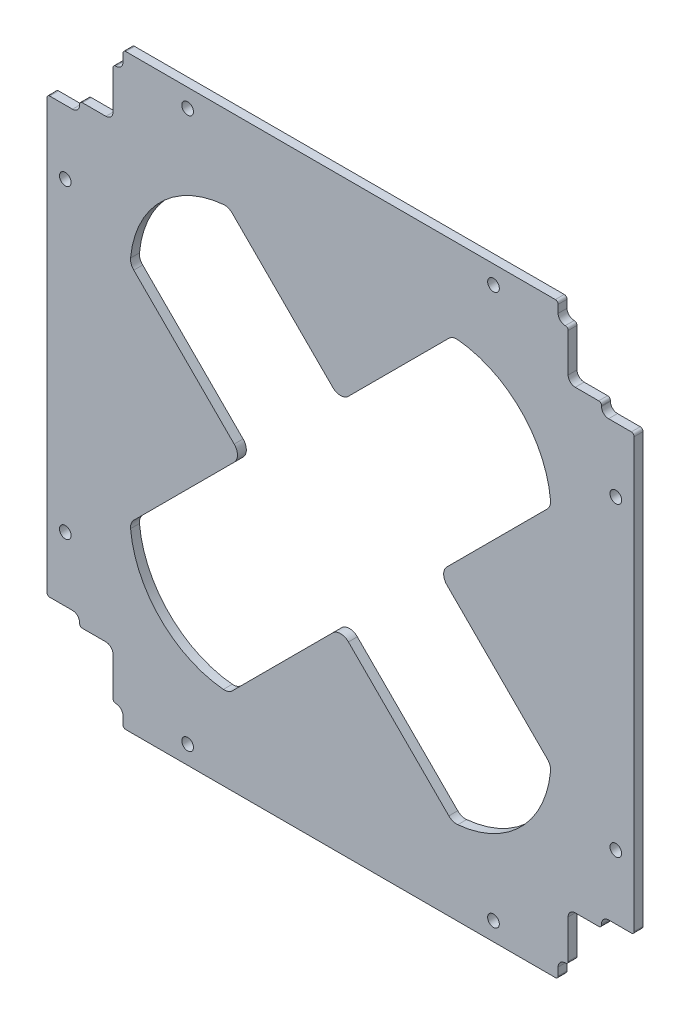
from build123d import *

# Parameters (mm, degrees)
SKETCH1_W                            = 106
SKETCH1_H                            = 106
MAINOUTLINE_DEPTH                    = 1.6
SKETCH4_W                            = 11.7
SKETCH4_H                            = 11.7
RAILCUTOUTS_DEPTH                    = 75.970394157
SKETCH13_W                           = 5.7
SKETCH13_H                           = 1.9
SKETCH13_W_2                         = 1.8
SKETCH13_H_2                         = 3
FILLETCUTOUTS_DEPTH                  = 75.970394157
SMOOTHCORNER_DEPTH                   = 10
MIRROR2_COPY_1_SKETCH_W              = 11.7
MIRROR2_COPY_1_SKETCH_H              = 11.7
MIRROR2_COPY_1_DEPTH                 = 75.970394157
MIRROR2_COPY_2_SKETCH_W              = 5.7
MIRROR2_COPY_2_SKETCH_H              = 1.9
MIRROR2_COPY_2_SKETCH_W_2            = 1.8
MIRROR2_COPY_2_SKETCH_H_2            = 3
MIRROR2_COPY_2_DEPTH                 = 75.970394157
MIRROR2_COPY_3_DEPTH                 = 10
MIRROR2_COPY_4_SKETCH_W              = 11.7
MIRROR2_COPY_4_SKETCH_H              = 11.7
MIRROR2_COPY_4_DEPTH                 = 75.970394157
MIRROR2_COPY_5_SKETCH_W              = 5.7
MIRROR2_COPY_5_SKETCH_H              = 1.9
MIRROR2_COPY_5_SKETCH_W_2            = 1.8
MIRROR2_COPY_5_SKETCH_H_2            = 3
MIRROR2_COPY_5_DEPTH                 = 75.970394157
MIRROR2_COPY_6_DEPTH                 = 10
FILLET10_R                           = 0.5
M2_CLEARANCE_HOLE1_D                 = 2.1
SKETCH15_W                           = 90
SKETCH15_H                           = 6.2
SKETCH15_W_2                         = 5.2
SKETCH15_H_2                         = 90
CUT_EXTRUDE5_DEPTH                   = 0.001
F_1I_CIRCULAR_TURNSTILE_CUTOUT_DEPTH = 10
SKETCH24_OUTSIDE_W                   = 137.984
SKETCH24_OUTSIDE_H                   = 137.984
SKETCH24_OUTSIDE_W_2                 = 105.6
SKETCH24_OUTSIDE_H_2                 = 105.6
CUT_EXTRUDE19_DEPTH                  = 75.970394157
FILLET7_R                            = 0.5
FILLET9_R                            = 2


with BuildPart() as part:
    # Sketch1 → mainOutline (new body)
    with BuildSketch(Plane.XY):
        Rectangle(SKETCH1_W, SKETCH1_H)
    extrude(amount=MAINOUTLINE_DEPTH)

    # Sketch4 → railCutouts (cut, through all)
    with BuildSketch(Plane(origin=(0, 0, 0), x_dir=(-1, 0, 0), z_dir=(0, 0, -1))):
        with Locations((47.15, 47.15)):
            Rectangle(SKETCH4_W, SKETCH4_H)
    railcutouts = extrude(amount=-RAILCUTOUTS_DEPTH, mode=Mode.SUBTRACT)

    # Sketch13 → filletCutouts (cut, symmetric)
    with BuildSketch(Plane(origin=(0, 0, 0), x_dir=(-1, 0, 0), z_dir=(0, 0, -1))):
        with Locations((50.15, 40.35)):
            Rectangle(SKETCH13_W, SKETCH13_H)
        with Locations((40.4, 51.5)):
            Rectangle(SKETCH13_W_2, SKETCH13_H_2)
    filletcutouts = extrude(amount=FILLETCUTOUTS_DEPTH, both=True, mode=Mode.SUBTRACT)

    # Sketch27 → smoothCorner (cut)
    with BuildSketch(Plane.XY.offset(1.6)):
        with BuildLine():
            Line((-40.928025612, 42.198025612), (-40.928025612, 49.628025612))
            Line((-40.928025612, 49.628025612), (-40.398025612, 49.628025612))
            ThreePointArc((-40.398025612, 49.628025612), (-39.5, 50), (-39.128025612, 50.898025612))
            Line((-39.128025612, 50.898025612), (-39.128025612, 53))
            Line((-39.128025612, 53), (-53, 53))
            Line((-53, 53), (-53, 39.028025612))
            Line((-53, 39.028025612), (-48.198025612, 39.028025612))
            ThreePointArc((-48.198025612, 39.028025612), (-47.3, 39.4), (-46.928025612, 40.298025612))
            Line((-46.928025612, 40.298025612), (-46.928025612, 40.928025612))
            Line((-46.928025612, 40.928025612), (-42.198025612, 40.928025612))
            ThreePointArc((-42.198025612, 40.928025612), (-41.3, 41.3), (-40.928025612, 42.198025612))
        make_face()
    smoothcorner = extrude(amount=-SMOOTHCORNER_DEPTH, mode=Mode.SUBTRACT)

    # Mirror1: railCutouts, filletCutouts, smoothCorner across plane
    add(railcutouts.mirror(Plane(origin=(0, 0, 0), x_dir=(0, 0, 1), z_dir=(1, 0, 0))), mode=Mode.SUBTRACT)
    add(filletcutouts.mirror(Plane(origin=(0, 0, 0), x_dir=(0, 0, 1), z_dir=(1, 0, 0))), mode=Mode.SUBTRACT)
    add(smoothcorner.mirror(Plane(origin=(0, 0, 0), x_dir=(0, 0, 1), z_dir=(1, 0, 0))), mode=Mode.SUBTRACT)

    # Mirror2 copy 1 sketch → Mirror2 copy 1 (cut, through all)
    with BuildSketch(Plane(origin=(0, 0, 0), x_dir=(1, 0, 0), z_dir=(0, 0, -1))):
        with Locations((47.15, 47.15)):
            Rectangle(MIRROR2_COPY_1_SKETCH_W, MIRROR2_COPY_1_SKETCH_H)
    extrude(amount=-MIRROR2_COPY_1_DEPTH, mode=Mode.SUBTRACT)

    # Mirror2 copy 2 sketch → Mirror2 copy 2 (cut, symmetric)
    with BuildSketch(Plane(origin=(0, 0, 0), x_dir=(1, 0, 0), z_dir=(0, 0, -1))):
        with Locations((50.15, 40.35)):
            Rectangle(MIRROR2_COPY_2_SKETCH_W, MIRROR2_COPY_2_SKETCH_H)
        with Locations((40.4, 51.5)):
            Rectangle(MIRROR2_COPY_2_SKETCH_W_2, MIRROR2_COPY_2_SKETCH_H_2)
    extrude(amount=MIRROR2_COPY_2_DEPTH, both=True, mode=Mode.SUBTRACT)

    # Mirror2 copy 3 sketch → Mirror2 copy 3 (cut)
    with BuildSketch(Plane(origin=(0, 0, 1.6), x_dir=(-1, 0, 0), z_dir=(0, 0, 1))):
        with BuildLine():
            Line((-40.928025612, 42.198025612), (-40.928025612, 49.628025612))
            Line((-40.928025612, 49.628025612), (-40.398025612, 49.628025612))
            ThreePointArc((-40.398025612, 49.628025612), (-39.5, 50), (-39.128025612, 50.898025612))
            Line((-39.128025612, 50.898025612), (-39.128025612, 53))
            Line((-39.128025612, 53), (-53, 53))
            Line((-53, 53), (-53, 39.028025612))
            Line((-53, 39.028025612), (-48.198025612, 39.028025612))
            ThreePointArc((-48.198025612, 39.028025612), (-47.3, 39.4), (-46.928025612, 40.298025612))
            Line((-46.928025612, 40.298025612), (-46.928025612, 40.928025612))
            Line((-46.928025612, 40.928025612), (-42.198025612, 40.928025612))
            ThreePointArc((-42.198025612, 40.928025612), (-41.3, 41.3), (-40.928025612, 42.198025612))
        make_face()
    extrude(amount=-MIRROR2_COPY_3_DEPTH, mode=Mode.SUBTRACT)

    # Mirror2 copy 4 sketch → Mirror2 copy 4 (cut, through all)
    with BuildSketch(Plane(origin=(0, 0, 0), x_dir=(-1, 0, 0), z_dir=(0, 0, -1))):
        with Locations((47.15, -47.15)):
            Rectangle(MIRROR2_COPY_4_SKETCH_W, MIRROR2_COPY_4_SKETCH_H)
    extrude(amount=-MIRROR2_COPY_4_DEPTH, mode=Mode.SUBTRACT)

    # Mirror2 copy 5 sketch → Mirror2 copy 5 (cut, symmetric)
    with BuildSketch(Plane(origin=(0, 0, 0), x_dir=(-1, 0, 0), z_dir=(0, 0, -1))):
        with Locations((50.15, -40.35)):
            Rectangle(MIRROR2_COPY_5_SKETCH_W, MIRROR2_COPY_5_SKETCH_H)
        with Locations((40.4, -51.5)):
            Rectangle(MIRROR2_COPY_5_SKETCH_W_2, MIRROR2_COPY_5_SKETCH_H_2)
    extrude(amount=MIRROR2_COPY_5_DEPTH, both=True, mode=Mode.SUBTRACT)

    # Mirror2 copy 6 sketch → Mirror2 copy 6 (cut)
    with BuildSketch(Plane.XY.offset(1.6)):
        with BuildLine():
            Line((-40.928025612, -42.198025612), (-40.928025612, -49.628025612))
            Line((-40.928025612, -49.628025612), (-40.398025612, -49.628025612))
            ThreePointArc((-40.398025612, -49.628025612), (-39.5, -50), (-39.128025612, -50.898025612))
            Line((-39.128025612, -50.898025612), (-39.128025612, -53))
            Line((-39.128025612, -53), (-53, -53))
            Line((-53, -53), (-53, -39.028025612))
            Line((-53, -39.028025612), (-48.198025612, -39.028025612))
            ThreePointArc((-48.198025612, -39.028025612), (-47.3, -39.4), (-46.928025612, -40.298025612))
            Line((-46.928025612, -40.298025612), (-46.928025612, -40.928025612))
            Line((-46.928025612, -40.928025612), (-42.198025612, -40.928025612))
            ThreePointArc((-42.198025612, -40.928025612), (-41.3, -41.3), (-40.928025612, -42.198025612))
        make_face()
    extrude(amount=-MIRROR2_COPY_6_DEPTH, mode=Mode.SUBTRACT)

    # Fillet10
    fillet10_edges = [part.edges().sort_by_distance(p)[0] for p in [
        (46.928025612, -40.928025612, 0.8),
        (40.928025612, -49.628025612, 0.8),
        (40.928025612, 49.628025612, 0.8),
        (46.928025612, 40.928025612, 0.8),
        (-46.928025612, 40.928025612, 0.8),
        (-40.928025612, 49.628025612, 0.8),
        (-46.928025612, -40.928025612, 0.8),
        (-40.928025612, -49.628025612, 0.8),
    ]]
    fillet(fillet10_edges, radius=FILLET10_R)

    # M2 Clearance Hole1 (through all)
    with Locations(Plane(origin=(0, 0, 0), x_dir=(-1, 0, 0), z_dir=(0, 0, -1))):
        with Locations((49.5, -27.5), (27.5, -49.5), (-49.5, -27.5), (-27.5, -49.5), (-27.5, 49.5), (-49.5, 27.5), (27.5, 49.5), (49.5, 27.5)):
            Hole(M2_CLEARANCE_HOLE1_D / 2)

    # Sketch15 → Cut-Extrude5 (cut)
    with BuildSketch(Plane(origin=(0, 0, 0), x_dir=(-1, 0, 0), z_dir=(0, 0, -1))):
        with Locations((0, 49.9)):
            Rectangle(SKETCH15_W, SKETCH15_H)
        with Locations((0, -49.9)):
            Rectangle(SKETCH15_W, SKETCH15_H)
        with Locations((-50.4, 0)):
            Rectangle(SKETCH15_W_2, SKETCH15_H_2)
        with Locations((50.4, 0)):
            Rectangle(SKETCH15_W_2, SKETCH15_H_2)
    extrude(amount=-CUT_EXTRUDE5_DEPTH, mode=Mode.SUBTRACT)

    # Sketch26 → 1I circular turnstile cutout (cut)
    with BuildSketch(Plane.XY.offset(1.6)):
        with BuildLine():
            Line((-17.713024869, 0), (-37.827495367, 20.114470498))
            ThreePointArc((-37.827495367, 20.114470498), (-32.425039857, 32.425039857), (-20.114470498, 37.827495367))
            Line((-20.114470498, 37.827495367), (0, 17.713024869))
            Line((0, 17.713024869), (20.114470498, 37.827495367))
            ThreePointArc((20.114470498, 37.827495367), (32.425039857, 32.425039857), (37.827495367, 20.114470498))
            Line((37.827495367, 20.114470498), (17.713024869, 0))
            Line((17.713024869, 0), (37.827495367, -20.114470498))
            ThreePointArc((37.827495367, -20.114470498), (32.425039857, -32.425039857), (20.114470498, -37.827495367))
            Line((20.114470498, -37.827495367), (0, -17.713024869))
            Line((0, -17.713024869), (-20.114470498, -37.827495367))
            ThreePointArc((-20.114470498, -37.827495367), (-32.425039857, -32.425039857), (-37.827495367, -20.114470498))
            Line((-37.827495367, -20.114470498), (-17.713024869, 0))
        make_face()
    extrude(amount=-F_1I_CIRCULAR_TURNSTILE_CUTOUT_DEPTH, mode=Mode.SUBTRACT)

    # Sketch24 outside → Cut-Extrude19 (cut, through all)
    with BuildSketch(Plane.XY.offset(1.6)):
        Rectangle(SKETCH24_OUTSIDE_W, SKETCH24_OUTSIDE_H)
        Rectangle(SKETCH24_OUTSIDE_W_2, SKETCH24_OUTSIDE_H_2, mode=Mode.SUBTRACT)
    extrude(amount=-CUT_EXTRUDE19_DEPTH, mode=Mode.SUBTRACT)

    # Fillet7
    fillet7_edges = [part.edges().sort_by_distance(p)[0] for p in [
        (-52.8, -39.028025612, 0.8005),
        (-39.128025612, -52.8, 0.8005),
        (39.128025612, -52.8, 0.8005),
        (52.8, -39.028025612, 0.8005),
        (52.8, 39.028025612, 0.8005),
        (39.128025612, 52.8, 0.8005),
        (-39.128025612, 52.8, 0.8005),
        (-52.8, 39.028025612, 0.8005),
    ]]
    fillet(fillet7_edges, radius=FILLET7_R)

    # Fillet9
    fillet9_edges = [part.edges().sort_by_distance(p)[0] for p in [
        (0, -17.713024869, 0.8),
        (17.713024869, 0, 0.8),
        (-17.713024869, 0, 0.8),
        (0, 17.713024869, 0.8),
        (-37.827495367, -20.114470498, 0.8),
        (-20.114470498, -37.827495367, 0.8),
        (20.114470498, -37.827495367, 0.8),
        (37.827495367, -20.114470498, 0.8),
        (37.827495367, 20.114470498, 0.8),
        (20.114470498, 37.827495367, 0.8),
        (-37.827495367, 20.114470498, 0.8),
        (-20.114470498, 37.827495367, 0.8),
    ]]
    fillet(fillet9_edges, radius=FILLET9_R)


solid = part.part
